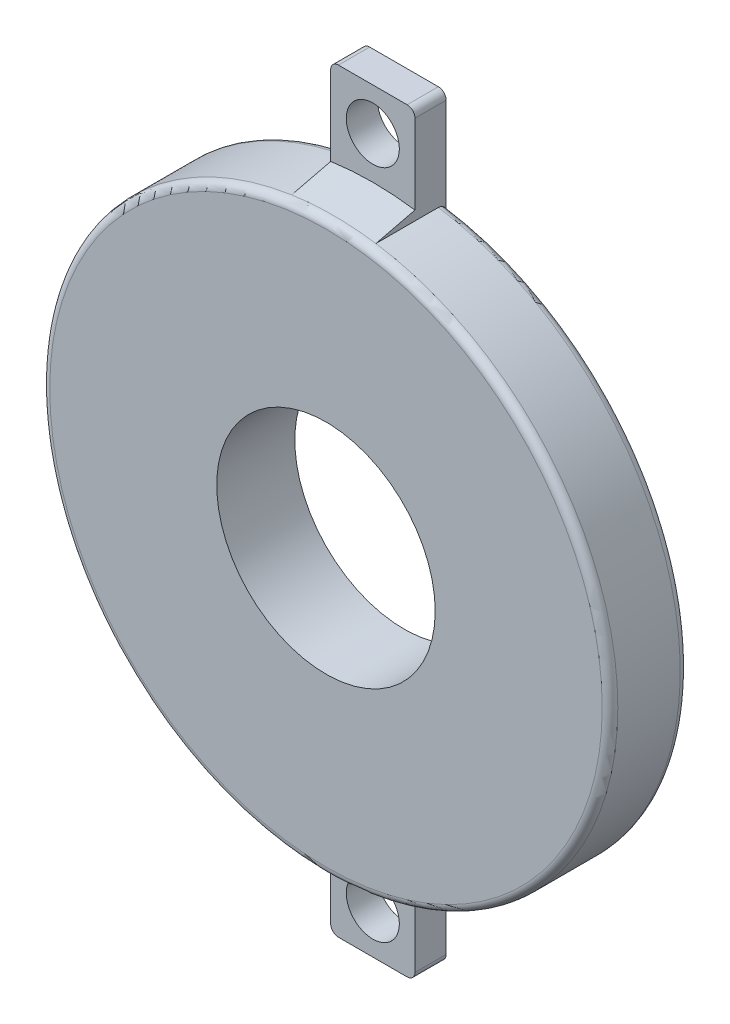
from build123d import *
from OCP.BRepFilletAPI import BRepFilletAPI_MakeChamfer

# Parameters (mm, degrees)
CROQUIS2_R              = 18.2
CROQUIS2_R_2            = 7
SALIENTE_EXTRUIR1_DEPTH = 5
CROQUIS2_3_R            = 1.7
SALIENTE_EXTRUIR2_DEPTH = 2
REDONDEO1_R             = 0.5
REDONDEO4_R             = 0.5
CHAFL_N2_SIZE           = 0.6
CHAFL_N2_SIZE_2         = 2.5


with BuildPart() as part:
    # Croquis2 → Saliente-Extruir1 (new body)
    with BuildSketch(Plane(origin=(0, 0, 0), x_dir=(0, 1, 0), z_dir=(0, 0, 1))):
        with Locations(Location((0, 0, 0), (0, 0, 270))):
            Circle(CROQUIS2_R)
        with Locations(Location((0, 0, 0), (0, 0, 270))):
            Circle(CROQUIS2_R_2, mode=Mode.SUBTRACT)
    extrude(amount=SALIENTE_EXTRUIR1_DEPTH)

    # Croquis2<3> → Saliente-Extruir2 (add)
    # profile 1 of 2: a face of its own
    with BuildSketch(Plane(origin=(0, 0, 0), x_dir=(0, 1, 0), z_dir=(0, 0, 1))):
        with BuildLine():
            Line((-24.2, -2.7), (-17.998611058, -2.7))
            ThreePointArc((-17.998611058, -2.7), (-18.2, 0), (-17.998611058, 2.7))
            Line((-17.998611058, 2.7), (-24.2, 2.7))
            Line((-24.2, 2.7), (-24.2, -2.7))
        make_face()
        with Locations(Location((-21.5, 0, 0), (0, 0, 270))):
            Circle(CROQUIS2_3_R, mode=Mode.SUBTRACT)
    # profile 2 of 2: a face of its own
    with BuildSketch(Plane(origin=(0, 0, 0), x_dir=(0, 1, 0), z_dir=(0, 0, 1))):
        with BuildLine():
            ThreePointArc((18.2, 0), (18.149582932, -1.353750116), (17.998611058, -2.7))
            Line((17.998611058, -2.7), (24.2, -2.7))
            Line((24.2, -2.7), (24.2, 2.7))
            Line((24.2, 2.7), (17.998611058, 2.7))
            ThreePointArc((17.998611058, 2.7), (18.149582932, 1.353750116), (18.2, 0))
        make_face()
        with Locations(Location((21.5, 0, 0), (0, 0, 270))):
            Circle(CROQUIS2_3_R, mode=Mode.SUBTRACT)
    extrude(amount=SALIENTE_EXTRUIR2_DEPTH)

    # Redondeo1
    redondeo1_edges = [part.edges().sort_by_distance(p)[0] for p in [
        (-2.7, -24.2, 1),
        (2.7, -24.2, 1),
        (2.7, 24.2, 1),
        (-2.7, 24.2, 1),
    ]]
    fillet(redondeo1_edges, radius=REDONDEO1_R)

    # Redondeo4
    redondeo4_edges = [part.edges().sort_by_distance(p)[0] for p in [
        (13.790939054, 11.87644728, 0),
        (-18.2, 0, 5),
        (-18.2, 0, 0),
    ]]
    fillet(redondeo4_edges, radius=REDONDEO4_R)

    # Chaflán2
    chafl_n2_edges_1 = [part.edges().sort_by_distance(p)[0] for p in [
        (0, -18.2, 2),
    ]]
    chafl_n2_side_1 = [part.faces().sort_by_distance(p)[0] for p in [
        (0, -18.212, 2),
    ]]
    chafl_n2_edges_2 = [part.edges().sort_by_distance(p)[0] for p in [
        (0, 18.2, 2),
    ]]
    chafl_n2_side_2 = [part.faces().sort_by_distance(p)[0] for p in [
        (0, 18.2, 2.012),
    ]]
    chafl_n2 = BRepFilletAPI_MakeChamfer(part.part.solid().wrapped)
    for e in chafl_n2_edges_1:
        chafl_n2.Add(CHAFL_N2_SIZE - 0.0001, CHAFL_N2_SIZE_2 - 0.0001, e.wrapped, chafl_n2_side_1[0].wrapped)
    for e in chafl_n2_edges_2:
        chafl_n2.Add(CHAFL_N2_SIZE_2 - 0.0001, CHAFL_N2_SIZE - 0.0001, e.wrapped, chafl_n2_side_2[0].wrapped)
    add(Compound.cast(chafl_n2.Shape()), mode=Mode.REPLACE)  # a hair under: the kernel refuses the full size


solid = part.part
